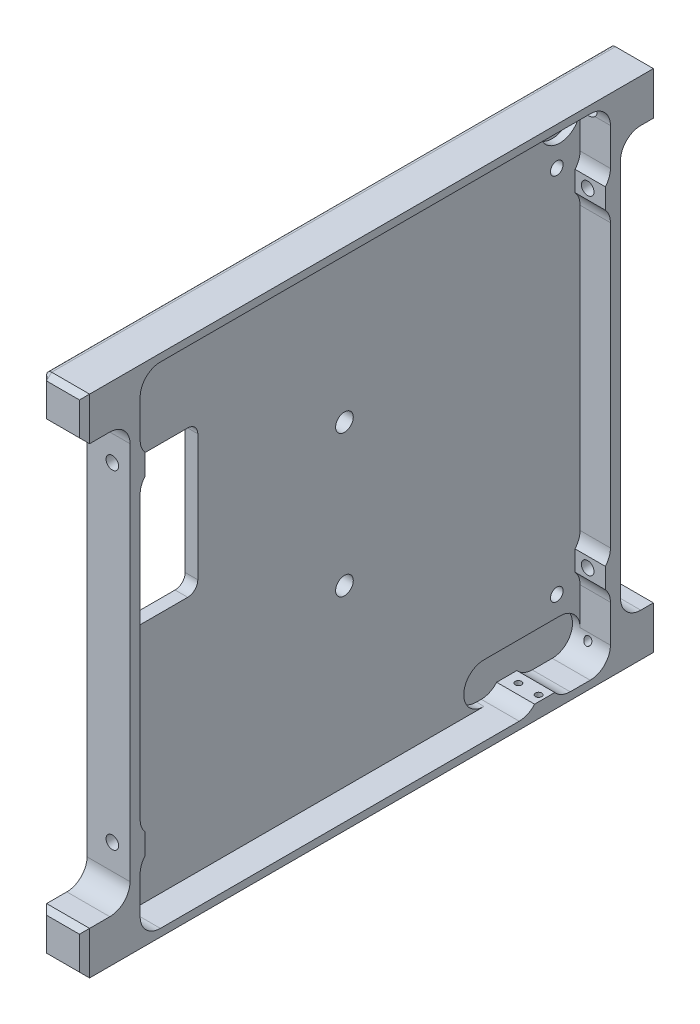
from build123d import *
from build123d.topology import SkipClean

# Parameters (mm, degrees)
SKETCH1_W                    = 81
SKETCH1_H                    = 83
BODY_DEPTH                   = 8.5
RAILFILLET_R                 = 1
FOOTCHAMFER_SIZE             = 1
SKETCH5_W                    = 81
SKETCH5_H                    = 83
BOSS_EXTRUDE3_DEPTH          = 8.5
SKETCH6_W                    = 93
SKETCH6_H                    = 97
CUT_EXTRUDE3_DEPTH           = 6
F_8_36_TAPPED_HOLE1_D        = 3.4544
F_8_36_TAPPED_HOLE1_DEPTH    = 13.55
F_8_36_TAPPED_HOLE1_TIP      = 1.037806461
SKETCH57_W                   = 1
SKETCH57_H                   = 4
BOSS_EXTRUDE24_DEPTH         = 6
FILLET5_R                    = 4
M3X0_5_TAPPED_HOLE1_D        = 2.5
FILLET7_R                    = 4
M3X0_5_TAPPED_HOLE2_D        = 2.5
M3X0_5_TAPPED_HOLE2_DEPTH    = 7.5
M3X0_5_TAPPED_HOLE2_TIP      = 0.751075774
FILLET8_R                    = 4
SKETCH70_R                   = 4
CUT_EXTRUDE14_DEPTH          = 1.5
SKETCH75_W                   = 7.5
SKETCH75_H                   = 4
BOSS_EXTRUDE25_DEPTH         = 1.4
M1_6X0_35_TAPPED_HOLE1_D     = 1.25
M1_6X0_35_TAPPED_HOLE1_DEPTH = 4.25
M1_6X0_35_TAPPED_HOLE1_TIP   = 0.375537887
FILLET9_R                    = 4
F_1_5MM_DOWEL_HOLE1_REACH    = 153.507
F_1_5MM_DOWEL_HOLE1_BORE_R   = 0.75
CUT_EXTRUDE15_DEPTH          = 152.387747196
SKETCH84_R                   = 1.75
CUT_EXTRUDE17_DEPTH          = 152.507425566


# Some blends are built 0.0001 mm under size
with BuildPart() as part:
    # Sketch1 → Body (new body)
    with BuildSketch(Plane(origin=(0, 0, 0), x_dir=(0, 0, -1), z_dir=(1, 0, 0))):
        Polygon((-113.5, 0), (0, 0), (0, 8.5), (-7.5, 8.5), (-7.5, 91.5), (0, 91.5), (0, 100), (-113.5, 100), (-113.5, 91.5), (-104.5, 91.5), (-104.5, 8.5), (-113.5, 8.5), align=None)
        with Locations((-56, 50)):
            Rectangle(SKETCH1_W, SKETCH1_H, mode=Mode.SUBTRACT)
    extrude(amount=BODY_DEPTH)

    # RailFillet
    railfillet_edges = [part.edges().sort_by_distance(p)[0] for p in [
        (0, 0, 56.75),
        (0, 100, 56.75),
    ]]
    fillet(railfillet_edges, radius=RAILFILLET_R)

    # FootChamfer
    footchamfer_edges = [part.edges().sort_by_distance(p)[0] for p in [
        (8.5, 95.75, 0),
        (0, 95.25, 113.5),
        (8.5, 95.75, 113.5),
        (0, 95.25, 0),
        (4.25, 8.5, 0),
        (4.75, 0, 0),
        (4.75, 0, 113.5),
        (4.25, 8.5, 113.5),
        (4.25, 91.5, 113.5),
        (4.75, 100, 113.5),
        (4.75, 100, 0),
        (4.25, 91.5, 0),
        (8.5, 4.25, 113.5),
        (8.5, 4.25, 0),
        (0, 4.75, 0),
        (0, 4.75, 113.5),
        (0.292893219, 0.292893219, 113.5),
        (0.292893219, 0.292893219, 0),
        (0.292893219, 99.707106781, 113.5),
        (0.292893219, 99.707106781, 0),
    ]]
    chamfer(footchamfer_edges, length=FOOTCHAMFER_SIZE - 0.0001)  # a hair under: the kernel refuses the full size

    # Sketch5 → Boss-Extrude3 (add)
    with BuildSketch(Plane(origin=(8.5, 0, 0), x_dir=(0, 0, -1), z_dir=(1, 0, 0))):
        with Locations((-56, 50)):
            Rectangle(SKETCH5_W, SKETCH5_H)
    extrude(amount=-BOSS_EXTRUDE3_DEPTH)

    # Sketch6 → Cut-Extrude3 (cut)
    with BuildSketch(Plane(origin=(8.5, 0, 0), x_dir=(0, 0, -1), z_dir=(1, 0, 0))):
        with Locations((-56, 50)):
            Rectangle(SKETCH6_W, SKETCH6_H)
    extrude(amount=-CUT_EXTRUDE3_DEPTH, mode=Mode.SUBTRACT)

    # #8-36 Tapped Hole1
    with Locations(Plane(origin=(0, 0, 0), x_dir=(-1, 0, 0), z_dir=(0, 0, -1))):
        with Locations((-4.25, 95.75)):
            Hole(F_8_36_TAPPED_HOLE1_D / 2, depth=F_8_36_TAPPED_HOLE1_DEPTH)
            with Locations((0, 0, -(F_8_36_TAPPED_HOLE1_DEPTH + F_8_36_TAPPED_HOLE1_TIP / 2))):  # 118° drill point
                Cone(0, F_8_36_TAPPED_HOLE1_D / 2, F_8_36_TAPPED_HOLE1_TIP, mode=Mode.SUBTRACT)

    # Sketch57 → Boss-Extrude24 (add)
    with BuildSketch(Plane(origin=(2.5, 0, 0), x_dir=(0, 0, -1), z_dir=(1, 0, 0))):
        with Locations((-102, 82.5)):
            Rectangle(SKETCH57_W, SKETCH57_H)
        with Locations((-102, 17.5)):
            Rectangle(SKETCH57_W, SKETCH57_H)
        with Locations((-10, 17.5)):
            Rectangle(SKETCH57_W, SKETCH57_H)
        with Locations((-10, 82.5)):
            Rectangle(SKETCH57_W, SKETCH57_H)
    extrude(amount=BOSS_EXTRUDE24_DEPTH)

    # Fillet5
    # the kernel refuses this fillet: 4 mm, written as the material it adds along each edge
    with BuildSketch(Plane(origin=(2.5, 84.5, 102.5), x_dir=(0, 1, 0), z_dir=(1, 0, 0)), Plane(origin=(2.5, 19.5, 102.5), x_dir=(0, 1, 0), z_dir=(1, 0, 0)), Plane(origin=(2.5, 15.5, 9.5), x_dir=(0, -1, 0), z_dir=(1, 0, 0)), Plane(origin=(2.5, 80.5, 9.5), x_dir=(0, -1, 0), z_dir=(1, 0, 0))) as fillet5_piece_1:
        with BuildLine():
            CenterArc((2.645751311, -4), FILLET5_R, 90, 41.409622109)
            Line((0, -1), (-0.052915026, -0.94))
            ThreePointArc((-0.052915026, -0.94), (-0.08, -0.5), (-0.08, 0))
            Line((-0.08, 0), (0, 0.08))
            Line((0, 0.08), (2.645751311, 0.08))
            Line((2.645751311, 0.08), (2.645751311, 0))
        make_face()
    extrude(amount=6)
    with BuildSketch(Plane(origin=(2.5, 80.5, 102.5), x_dir=(0, -1, 0), z_dir=(1, 0, 0)), Plane(origin=(2.5, 15.5, 102.5), x_dir=(0, -1, 0), z_dir=(1, 0, 0)), Plane(origin=(2.5, 19.5, 9.5), x_dir=(0, 1, 0), z_dir=(1, 0, 0)), Plane(origin=(2.5, 84.5, 9.5), x_dir=(0, 1, 0), z_dir=(1, 0, 0))) as fillet5_piece_2:
        with BuildLine():
            CenterArc((2.645751311, 4), FILLET5_R, 228.590377891, 41.409622109)
            Line((0, 1), (-0.052915026, 0.94))
            ThreePointArc((-0.052915026, 0.94), (-0.08, 0.5), (-0.08, 0))
            Line((-0.08, 0), (0, -0.08))
            Line((0, -0.08), (2.645751311, -0.08))
            Line((2.645751311, -0.08), (2.645751311, 0))
        make_face()
    extrude(amount=6)

    # M3x0.5 Tapped Hole1 (through all)
    with Locations(Plane(origin=(0, 0, 7.5), x_dir=(-1, 0, 0), z_dir=(0, 0, -1))):
        with Locations((-5, 82.5), (-5, 17.5)):
            Hole(M3X0_5_TAPPED_HOLE1_D / 2)

    # Fillet7
    # the kernel refuses this fillet: 4 mm, written as the material it adds along each edge
    with BuildSketch(Plane(origin=(8.5, 1.5, 102.5), x_dir=(0, 1, 0), z_dir=(-1, 0, 0)), Plane(origin=(8.5, 98.5, 102.5), x_dir=(0, 0, -1), z_dir=(-1, 0, 0)), Plane(origin=(8.5, 1.5, 9.5), x_dir=(0, 0, 1), z_dir=(-1, 0, 0))) as fillet7_piece_1:
        with BuildLine():
            CenterArc((FILLET7_R, FILLET7_R), FILLET7_R, 180, 90)
            Line((0, FILLET7_R), (0, 0))
            Line((0, 0), (FILLET7_R, 0))
        make_face()
    extrude(amount=6)
    with BuildSketch(Plane(origin=(8.5, 98.5, 9.5), x_dir=(0, -1, 0), z_dir=(-1, 0, 0))) as fillet7_piece_2_section:
        with BuildLine():
            CenterArc((FILLET7_R, FILLET7_R), FILLET7_R, 180, 90)
            Line((0, FILLET7_R), (0, 0))
            Line((0, 0), (FILLET7_R, 0))
        make_face()
    fillet7_piece_2 = extrude(amount=6, mode=Mode.PRIVATE)
    fillet7_piece_2 = fillet7_piece_2 - Plane(origin=(4.25, 95.75, 10.518489618), x_dir=(1, 0, 0), z_dir=(0, 0, 1)) * Cylinder(1.7272, 28, mode=Mode.PRIVATE)
    add(fillet7_piece_2)

    # M3x0.5 Tapped Hole2
    with Locations(Plane.ZY):
        with Locations((14.1, 13.5), (14.1, 86.5), (98.1, 86.5), (98.1, 13.5)):
            Hole(M3X0_5_TAPPED_HOLE2_D / 2, depth=M3X0_5_TAPPED_HOLE2_DEPTH)
            with Locations((0, 0, -(M3X0_5_TAPPED_HOLE2_DEPTH + M3X0_5_TAPPED_HOLE2_TIP / 2))):  # 118° drill point
                Cone(0, M3X0_5_TAPPED_HOLE2_D / 2, M3X0_5_TAPPED_HOLE2_TIP, mode=Mode.SUBTRACT)

    # Fillet8
    fillet8_edges = [part.edges().sort_by_distance(p)[0] for p in [
        (4.25, 8.5, 7.5),
        (4.25, 8.5, 104.5),
        (4.25, 91.5, 104.5),
        (4.25, 91.5, 7.5),
    ]]
    fillet(fillet8_edges, radius=FILLET8_R)

    # Sketch70 → Cut-Extrude14 (cut)
    with BuildSketch(Plane(origin=(2.5, 0, 0), x_dir=(0, 0, -1), z_dir=(1, 0, 0))):
        with BuildLine():
            ThreePointArc((-13.5, 1.5), (-9.5, 5.5), (-13.5, 9.5))
            Line((-13.5, 9.5), (-28.5, 9.5))
            ThreePointArc((-28.5, 9.5), (-32.5, 5.5), (-28.5, 1.5))
            Line((-28.5, 1.5), (-13.5, 1.5))
        make_face()
        with Locations((-13.5, 94.5)):
            Circle(SKETCH70_R)
    extrude(amount=-CUT_EXTRUDE14_DEPTH, mode=Mode.SUBTRACT)

    # Sketch75 → Boss-Extrude25 (add)
    with BuildSketch(Plane(origin=(0, 1.5, 0), x_dir=(1, 0, 0), z_dir=(0, 1, 0))):
        with Locations((4.75, -22.5)):
            Rectangle(SKETCH75_W, SKETCH75_H)
    extrude(amount=BOSS_EXTRUDE25_DEPTH)

    # M1.6x0.35 Tapped Hole1
    with Locations(Plane(origin=(0, 2.9, 0), x_dir=(1, 0, 0), z_dir=(0, 1, 0))):
        with Locations((3.3, -22.5), (7.3, -22.5)):
            Hole(M1_6X0_35_TAPPED_HOLE1_D / 2, depth=M1_6X0_35_TAPPED_HOLE1_DEPTH)
            with Locations((0, 0, -(M1_6X0_35_TAPPED_HOLE1_DEPTH + M1_6X0_35_TAPPED_HOLE1_TIP / 2))):  # 118° drill point
                Cone(0, M1_6X0_35_TAPPED_HOLE1_D / 2, M1_6X0_35_TAPPED_HOLE1_TIP, mode=Mode.SUBTRACT)

    # Fillet9
    # the kernel refuses this fillet: 4 mm, written as the material it adds along each edge
    with BuildSketch(Plane(origin=(8.5, 1.5, 24.5), x_dir=(0, 1, 0), z_dir=(-1, 0, 0))) as fillet9_piece_1:
        with BuildLine():
            CenterArc((4, -3.039736831), FILLET9_R, 130.541601874, 49.458398126)
            Line((0, -3.039736831), (-0.08, -3.039736831))
            Line((-0.08, -3.039736831), (-0.08, 0))
            Line((-0.08, 0), (0, 0.08))
            ThreePointArc((0, 0.08), (0.7, 0.08), (1.348, 0.060794737))
            Line((1.348, 0.060794737), (1.4, 0))
        make_face()
    extrude(amount=6)
    with BuildSketch(Plane(origin=(2.5, 1.5, 20.5), x_dir=(0, 0, -1), z_dir=(1, 0, 0))) as fillet9_piece_2:
        with BuildLine():
            CenterArc((3.039736831, 4), FILLET9_R, 220.541601874, 49.458398126)
            Line((0, 1.4), (-0.060794737, 1.348))
            ThreePointArc((-0.060794737, 1.348), (-0.08, 0.7), (-0.08, 0))
            Line((-0.08, 0), (0, -0.08))
            Line((0, -0.08), (3.039736831, -0.08))
            Line((3.039736831, -0.08), (3.039736831, 0))
        make_face()
    extrude(amount=6)
    with BuildSketch(Plane(origin=(1, 1.5, 20.5), x_dir=(0, 1, 0), z_dir=(1, 0, 0)), Plane(origin=(2.5, 1.5, 24.5), x_dir=(0, 1, 0), z_dir=(-1, 0, 0))) as fillet9_piece_3:
        with BuildLine():
            CenterArc((4, -3.039736831), FILLET9_R, 130.541601874, 49.458398126)
            Line((0, -3.039736831), (-0.08, -3.039736831))
            Line((-0.08, -3.039736831), (-0.08, 0))
            Line((-0.08, 0), (0, 0.08))
            ThreePointArc((0, 0.08), (0.7, 0.08), (1.348, 0.060794737))
            Line((1.348, 0.060794737), (1.4, 0))
        make_face()
    extrude(amount=1.5)

    # Ø1.5mm Dowel Hole1 bore → Ø1.5mm Dowel Hole1 (cut, up to next)
    with BuildSketch(Plane(origin=(0, 0, 0), x_dir=(-1, 0, 0), z_dir=(0, 0, -1)), mode=Mode.PRIVATE) as f_1_5mm_dowel_hole1_sk1:
        with Locations((-4.25, 4.25)):
            Circle(F_1_5MM_DOWEL_HOLE1_BORE_R)
    f_1_5mm_dowel_hole1_tool1 = extrude(f_1_5mm_dowel_hole1_sk1.sketch, amount=-F_1_5MM_DOWEL_HOLE1_REACH, mode=Mode.PRIVATE) & part.part
    add(f_1_5mm_dowel_hole1_tool1.solids().sort_by_distance((4.25, 4.25, 0))[0], mode=Mode.SUBTRACT)

    # Sketch81 → Cut-Extrude15 (cut, through all)
    with SkipClean():  # the faces are left unmerged after this step: merging them gives an invalid solid
        with BuildSketch(Plane(origin=(2.5, 0, 0), x_dir=(0, 0, -1), z_dir=(1, 0, 0))):
            with BuildLine():
                ThreePointArc((-102.5, 51.5), (-101.914213562, 50.085786438), (-100.5, 49.5))
                ThreePointArc((-100.5, 49.5), (-99.085786438, 50.085786438), (-98.5, 51.5))
                Line((-98.5, 51.5), (-98.5, 76.5))
                ThreePointArc((-98.5, 76.5), (-99.085786438, 77.914213562), (-100.5, 78.5))
                ThreePointArc((-100.5, 78.5), (-101.914213562, 77.914213562), (-102.5, 76.5))
                Line((-102.5, 76.5), (-102.5, 51.5))
            make_face()
            with BuildLine():
                Line((-85.1, 51.5), (-85.1, 76.5))
                ThreePointArc((-85.1, 76.5), (-87.1, 78.5), (-89.1, 76.5))
                Line((-89.1, 76.5), (-89.1, 51.5))
                ThreePointArc((-89.1, 51.5), (-87.1, 49.5), (-85.1, 51.5))
            make_face()
            with BuildLine():
                ThreePointArc((-87.1, 49.5), (-88.514213562, 50.085786438), (-89.1, 51.5))
                Line((-89.1, 51.5), (-89.1, 76.5))
                ThreePointArc((-89.1, 76.5), (-88.514213562, 77.914213562), (-87.1, 78.5))
                Line((-87.1, 78.5), (-100.5, 78.5))
                ThreePointArc((-100.5, 78.5), (-99.085786438, 77.914213562), (-98.5, 76.5))
                Line((-98.5, 76.5), (-98.5, 51.5))
                ThreePointArc((-98.5, 51.5), (-99.085786438, 50.085786438), (-100.5, 49.5))
                Line((-100.5, 49.5), (-87.1, 49.5))
            make_face()
        extrude(amount=-CUT_EXTRUDE15_DEPTH, mode=Mode.SUBTRACT)

    # Sketch84 → Cut-Extrude17 (cut, through all)
    with SkipClean():  # the faces are left unmerged after this step: merging them gives an invalid solid
        with BuildSketch(Plane.ZY):
            with Locations((56.1, 36)):
                Circle(SKETCH84_R)
            with Locations((56.1, 64)):
                Circle(SKETCH84_R)
        extrude(amount=-CUT_EXTRUDE17_DEPTH, mode=Mode.SUBTRACT)


solid = part.part
